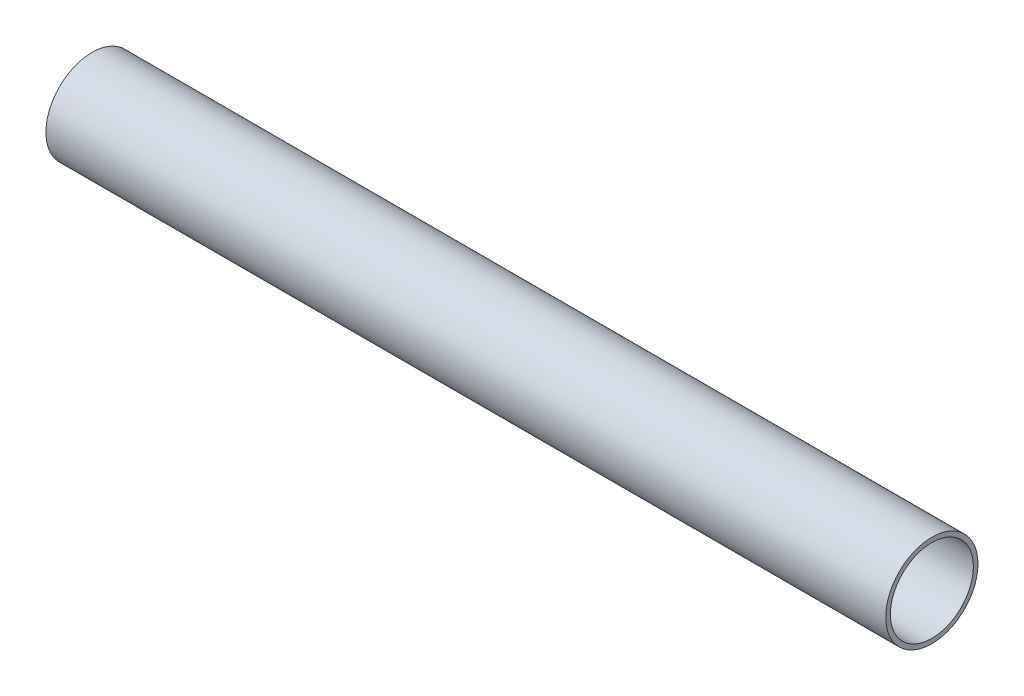
from build123d import *

# Parameters (mm, degrees)
SKETCH1_R           = 15.875
SKETCH1_R_2         = 14.2875
EXTRUDE_THIN1_DEPTH = 144.462496698


with BuildPart() as part:
    # Sketch1 → Extrude-Thin1 (new, symmetric)
    with BuildSketch(Plane(origin=(0, 0, 0), x_dir=(0, 0, -1), z_dir=(1, 0, 0))):
        Circle(SKETCH1_R)
        Circle(SKETCH1_R_2, mode=Mode.SUBTRACT)
    extrude(amount=EXTRUDE_THIN1_DEPTH, both=True)


solid = part.part
